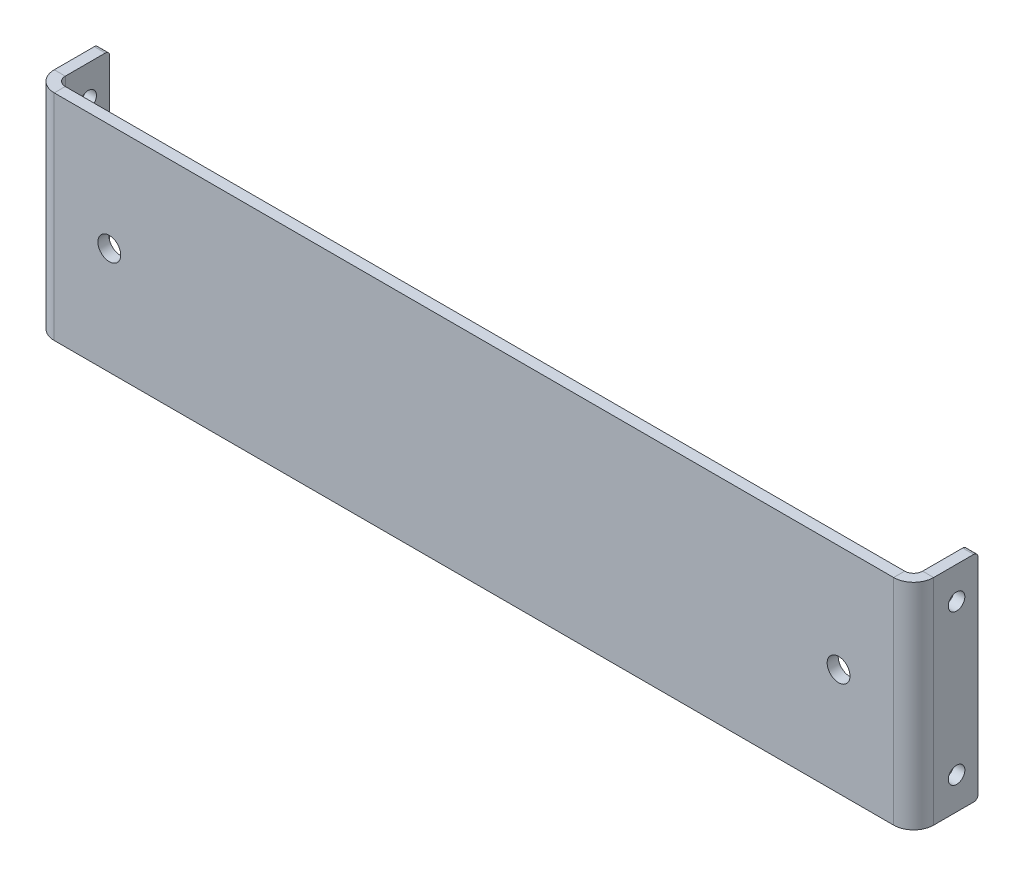
from build123d import *

# Parameters (mm, degrees)
SKETCH1_W                      = 260.35
SKETCH1_H                      = 63.5
BASE_FLANGE1_DEPTH             = 3.2639
EDGE_FLANGE1_STRIP_W           = 18.36928
EDGE_FLANGE1_STRIP_H           = 3.2639
EDGE_FLANGE1_STRIP_CUT_DEPTH   = 63.5
EDGE_FLANGE1_STRIP_2_W         = 18.36928
EDGE_FLANGE1_STRIP_2_H         = 3.2639
EDGE_FLANGE1_STRIP_CUT_2_DEPTH = 63.5
EDGE_FLANGE1_DEPTH             = 63.5
EDGE_FLANGE1_BEND_DEPTH        = 63.5
F_10_0_1935_DIAMETER_HOLE1_D   = 4.9149
FILLET1_R                      = 1.27
F_1_4_CLEARANCE_HOLE1_D        = 6.7564


# Sheet-metal steps are written as plain solids
with BuildPart() as part:
    # Sketch1 → Base-Flange1 (new body)
    with BuildSketch(Plane.XY):
        Rectangle(SKETCH1_W, SKETCH1_H)
    extrude(amount=-BASE_FLANGE1_DEPTH)

    # Edge-Flange1 strip (across the edge) → Edge-Flange1 strip cut (cut)
    with BuildSketch(Plane(origin=(130.175, 31.75, -3.2639), x_dir=(-1, 0, 0), z_dir=(0, -1, 0))):
        with Locations((-3.2639, -1.63195)):
            Rectangle(EDGE_FLANGE1_STRIP_W, EDGE_FLANGE1_STRIP_H)
    extrude(amount=EDGE_FLANGE1_STRIP_CUT_DEPTH, mode=Mode.SUBTRACT)

    # Edge-Flange1 strip 2 (across the edge) → Edge-Flange1 strip cut 2 (cut)
    with BuildSketch(Plane(origin=(-130.175, -31.75, -3.2639), x_dir=(1, 0, 0), z_dir=(0, 1, 0))):
        with Locations((-3.2639, -1.63195)):
            Rectangle(EDGE_FLANGE1_STRIP_2_W, EDGE_FLANGE1_STRIP_2_H)
    extrude(amount=EDGE_FLANGE1_STRIP_CUT_2_DEPTH, mode=Mode.SUBTRACT)

    # Edge-Flange1 section (across the edge) → Edge-Flange1 (add)
    with BuildSketch(Plane(origin=(130.175, 31.75, -3.2639), x_dir=(-1, 0, 0), z_dir=(0, -1, 0))):
        with BuildLine():
            Line((0, 2.65684), (0, 15.7861))
            Line((0, 15.7861), (3.2639, 15.7861))
            Line((3.2639, 15.7861), (3.2639, 2.65684))
            ThreePointArc((3.2639, 2.65684), (4.042070419, 0.778170419), (5.92074, 0))
            Line((5.92074, 0), (5.92074, -3.2639))
            ThreePointArc((5.92074, -3.2639), (1.734144596, -1.529755404), (0, 2.65684))
        make_face()
    extrude(amount=EDGE_FLANGE1_DEPTH)

    # Edge-Flange1 section 2 (across the edge) → Edge-Flange1 bend (add)
    with BuildSketch(Plane(origin=(-130.175, -31.75, -3.2639), x_dir=(1, 0, 0), z_dir=(0, 1, 0))):
        with BuildLine():
            Line((0, 2.65684), (0, 15.7861))
            Line((0, 15.7861), (3.2639, 15.7861))
            Line((3.2639, 15.7861), (3.2639, 2.65684))
            ThreePointArc((3.2639, 2.65684), (4.042070419, 0.778170419), (5.92074, 0))
            Line((5.92074, 0), (5.92074, -3.2639))
            ThreePointArc((5.92074, -3.2639), (1.734144596, -1.529755404), (0, 2.65684))
        make_face()
    extrude(amount=EDGE_FLANGE1_BEND_DEPTH)

    # #10 (0.1935) Diameter Hole1 (through all)
    with Locations(Plane(origin=(130.175, 0, 0), x_dir=(0, 0, -1), z_dir=(1, 0, 0))):
        with Locations((12.7, 22.225), (12.7, -22.225)):
            Hole(F_10_0_1935_DIAMETER_HOLE1_D / 2)

    # Fillet1
    fillet1_edges = [part.edges().sort_by_distance(p)[0] for p in [
        (128.54305, 31.75, -19.05),
        (128.54305, -31.75, -19.05),
        (-128.54305, -31.75, -19.05),
        (-128.54305, 31.75, -19.05),
    ]]
    fillet(fillet1_edges, radius=FILLET1_R)

    # 1/4 Clearance Hole1 (through all)
    with Locations(Plane.XY):
        with Locations((-107.95, 0), (107.95, 0)):
            Hole(F_1_4_CLEARANCE_HOLE1_D / 2)


solid = part.part
